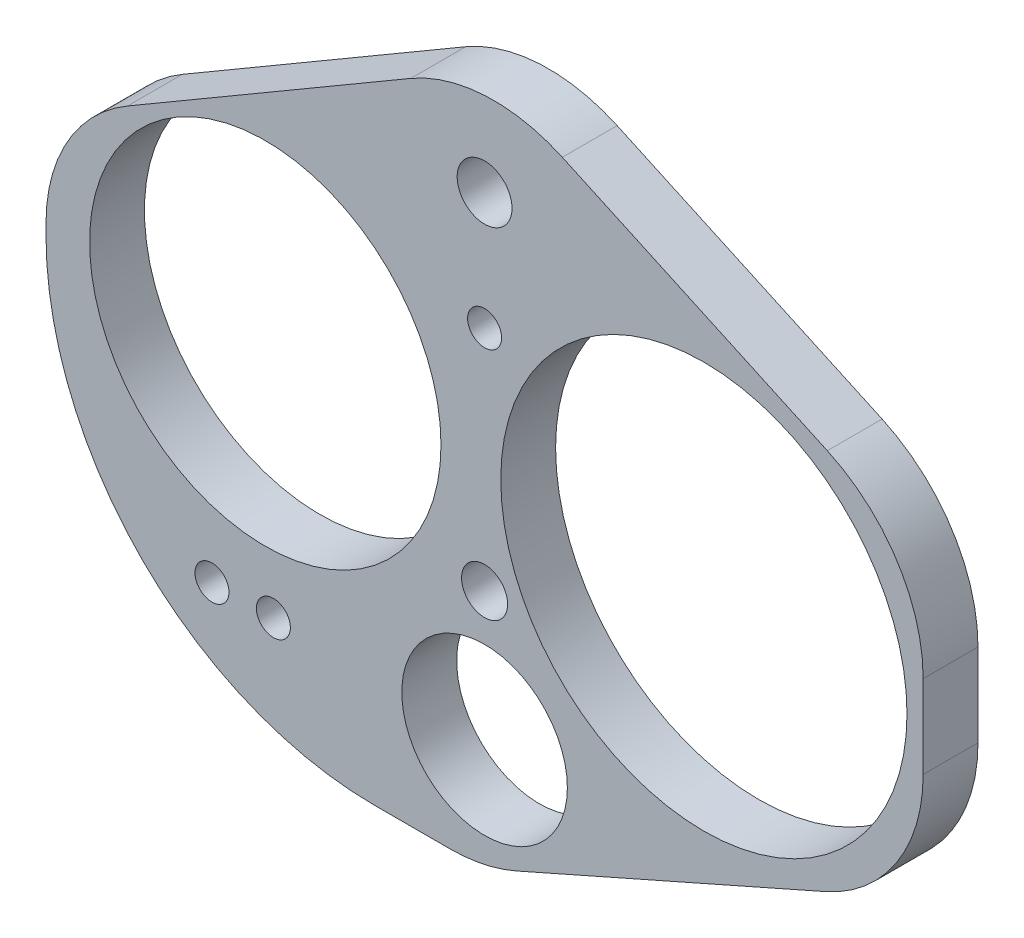
from build123d import *

# Parameters (mm, degrees)
SKETCH1_R           = 1.55
SKETCH1_R_2         = 16.025
SKETCH1_R_3         = 7.55
SKETCH1_R_4         = 2.1
SKETCH1_R_5         = 18.525
SKETCH1_R_6         = 2.5
BOSS_EXTRUDE1_DEPTH = 5
FILLET1_R           = 15
FILLET2_R           = 30


with BuildPart() as part:
    # Sketch1 → Boss-Extrude1 (new body)
    with BuildSketch(Plane.XY):
        Polygon((-20, 8.126584262), (-20, -31.5), (20, -31.5), (60, -13.814957213), (60, 13.141793742), (20, 31.5), align=None)
        with Locations((-4.862894827, -21.316811866)):
            Circle(SKETCH1_R, mode=Mode.SUBTRACT)
        with BuildLine():
            ThreePointArc((2.287105173, -21.316811866), (0.737105173, -22.866811866), (-0.812894827, -21.316811866))
            ThreePointArc((-0.812894827, -21.316811866), (0.737105173, -19.766811866), (2.287105173, -21.316811866))
        make_face(mode=Mode.SUBTRACT)
        Circle(SKETCH1_R_2, mode=Mode.SUBTRACT)
        with Locations((20, -21.316811866)):
            Circle(SKETCH1_R_3, mode=Mode.SUBTRACT)
        with Locations((20, -9.557095977)):
            Circle(SKETCH1_R_4, mode=Mode.SUBTRACT)
        with Locations((40, 0)):
            Circle(SKETCH1_R_5, mode=Mode.SUBTRACT)
        with Locations((20, 11.209005776)):
            Circle(SKETCH1_R, mode=Mode.SUBTRACT)
        with Locations((20, 21.918567686)):
            Circle(SKETCH1_R_6, mode=Mode.SUBTRACT)
    extrude(amount=BOSS_EXTRUDE1_DEPTH)

    # Fillet1
    fillet1_edges = [part.edges().sort_by_distance(p)[0] for p in [
        (60, -13.814957213, 2.5),
        (60, 13.141793742, 2.5),
        (20, 31.5, 2.5),
        (-20, 8.126584262, 2.5),
        (20, -31.5, 2.5),
    ]]
    fillet(fillet1_edges, radius=FILLET1_R)

    # Fillet2
    fillet2_edges = [part.edges().sort_by_distance(p)[0] for p in [
        (-20, -31.5, 2.5),
    ]]
    fillet(fillet2_edges, radius=FILLET2_R)


solid = part.part
